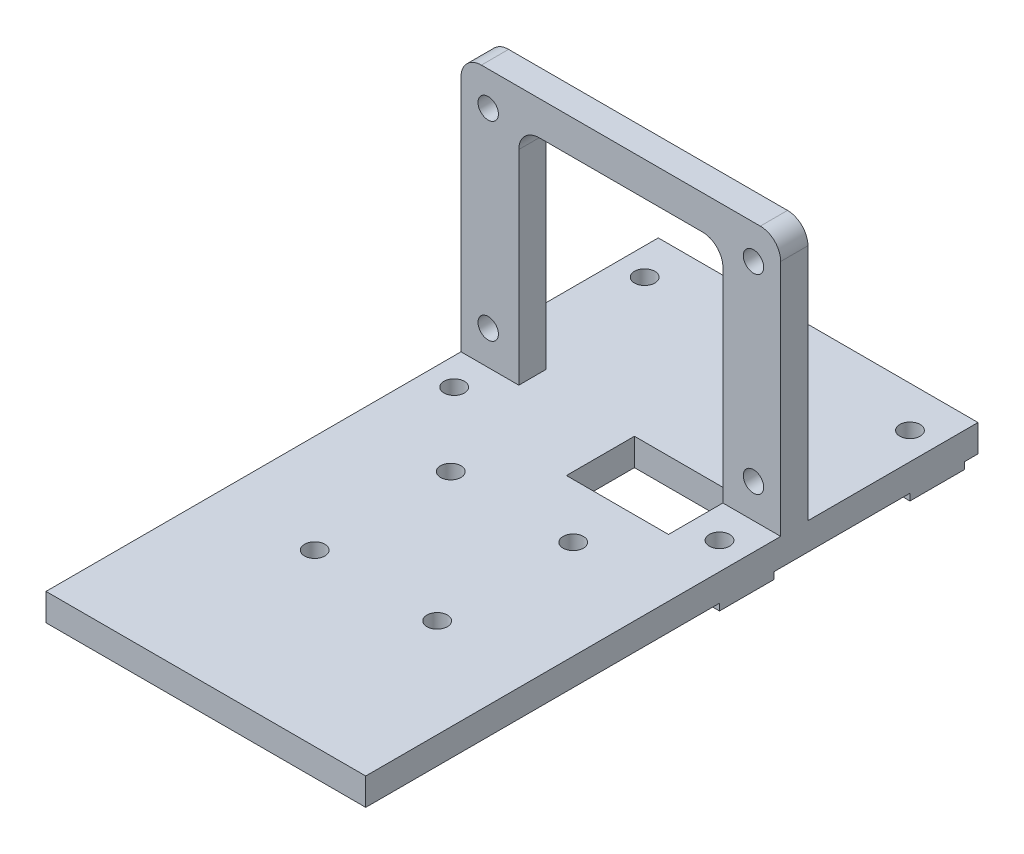
from build123d import *

# Parameters (mm, degrees)
SKETCH_1_W          = 47
SKETCH_1_H          = 90
SKETCH_1_R          = 1.5
SKETCH_1_W_2        = 15
SKETCH_1_H_2        = 10
EXTRUDE_1_DEPTH     = 4
EXTRUDE_START       = 1
SKETCH_3_W          = 8
SKETCH_3_H          = 8
SKETCH_3_R          = 1.5
EXTRUDE_2_DEPTH     = 1
SKETCH_4_R          = 1.5
CUT_EXTRUDE_2_DEPTH = 4
SKETCH_5_W          = 8.5
SKETCH_5_H          = 4
EXTRUDE_3_DEPTH     = 38
SKETCH_6_R          = 1.5
CUT_EXTRUDE_3_DEPTH = 10
SKETCH_7_W          = 30
SKETCH_7_H          = 5
EXTRUDE_4_DEPTH     = 4
FILLET_1_R          = 3


with BuildPart() as part:
    # 草图1 → 凸台-拉伸1 (new body)
    with BuildSketch(Plane(origin=(0, 0, 0), x_dir=(1, 0, 0), z_dir=(0, 1, 0))):
        with Locations((0, -25)):
            Rectangle(SKETCH_1_W, SKETCH_1_H)
        with Locations((-19.5, -14)):
            Circle(SKETCH_1_R, mode=Mode.SUBTRACT)
        with Locations((7.5, -12)):
            Rectangle(SKETCH_1_W_2, SKETCH_1_H_2, mode=Mode.SUBTRACT)
        with Locations((-19.5, 14)):
            Circle(SKETCH_1_R, mode=Mode.SUBTRACT)
        with Locations((19.5, -14)):
            Circle(SKETCH_1_R, mode=Mode.SUBTRACT)
        with Locations((19.5, 14)):
            Circle(SKETCH_1_R, mode=Mode.SUBTRACT)
    extrude(amount=EXTRUDE_1_DEPTH)

    # 草图3 → 凸台-拉伸2 (add)
    # profile 1 of 4: a face of its own
    with BuildSketch(Plane.XZ.offset(EXTRUDE_START)):
        with Locations((19.5, -14)):
            Rectangle(SKETCH_3_W, SKETCH_3_H)
        with Locations((19.5, -14)):
            Circle(SKETCH_3_R, mode=Mode.SUBTRACT)
    # profile 2 of 4: a face of its own
    with BuildSketch(Plane.XZ.offset(EXTRUDE_START)):
        with Locations((19.5, 14)):
            Rectangle(SKETCH_3_W, SKETCH_3_H)
        with Locations((19.5, 14)):
            Circle(SKETCH_3_R, mode=Mode.SUBTRACT)
    # profile 3 of 4: a face of its own
    with BuildSketch(Plane.XZ.offset(EXTRUDE_START)):
        with Locations((-19.5, -14)):
            Rectangle(SKETCH_3_W, SKETCH_3_H)
        with Locations((-19.5, -14)):
            Circle(SKETCH_3_R, mode=Mode.SUBTRACT)
    # profile 4 of 4: a face of its own
    with BuildSketch(Plane.XZ.offset(EXTRUDE_START)):
        with Locations((-19.5, 14)):
            Rectangle(SKETCH_3_W, SKETCH_3_H)
        with Locations((-19.5, 14)):
            Circle(SKETCH_3_R, mode=Mode.SUBTRACT)
    extrude(amount=-EXTRUDE_2_DEPTH)

    # 草图4 → 切除-拉伸2 (cut)
    with BuildSketch(Plane(origin=(0, 4, 0), x_dir=(1, 0, 0), z_dir=(0, 1, 0))):
        with Locations((9, -25)):
            Circle(SKETCH_4_R)
        with Locations((9, -45)):
            Circle(SKETCH_4_R)
        with Locations((-9, -45)):
            Circle(SKETCH_4_R)
        with Locations((-9, -25)):
            Circle(SKETCH_4_R)
    extrude(amount=-CUT_EXTRUDE_2_DEPTH, mode=Mode.SUBTRACT)

    # 草图5 → 凸台-拉伸3 (add)
    with BuildSketch(Plane(origin=(0, 4, 0), x_dir=(1, 0, 0), z_dir=(0, 1, 0))):
        with Locations((19.25, -7)):
            Rectangle(SKETCH_5_W, SKETCH_5_H)
        with Locations((-19.25, -7)):
            Rectangle(SKETCH_5_W, SKETCH_5_H)
    extrude(amount=EXTRUDE_3_DEPTH)

    # 草图6 → 切除-拉伸3 (cut)
    with BuildSketch(Plane.XY.offset(9)):
        with Locations((19.5, 37)):
            Circle(SKETCH_6_R)
        with Locations((19.5, 9)):
            Circle(SKETCH_6_R)
        with Locations((-19.5, 9)):
            Circle(SKETCH_6_R)
        with Locations((-19.5, 37)):
            Circle(SKETCH_6_R)
    extrude(amount=-CUT_EXTRUDE_3_DEPTH, mode=Mode.SUBTRACT)

    # 草图7 → 凸台-拉伸4 (add)
    with BuildSketch(Plane.XY.offset(9)):
        with Locations((0, 39.5)):
            Rectangle(SKETCH_7_W, SKETCH_7_H)
    extrude(amount=-EXTRUDE_4_DEPTH)

    # 圆角1
    fillet_1_edges = [part.edges().sort_by_distance(p)[0] for p in [
        (-23.5, 42, 7),
        (23.5, 42, 7),
        (15, 37, 7),
        (-15, 37, 7),
    ]]
    fillet(fillet_1_edges, radius=FILLET_1_R)


solid = part.part
